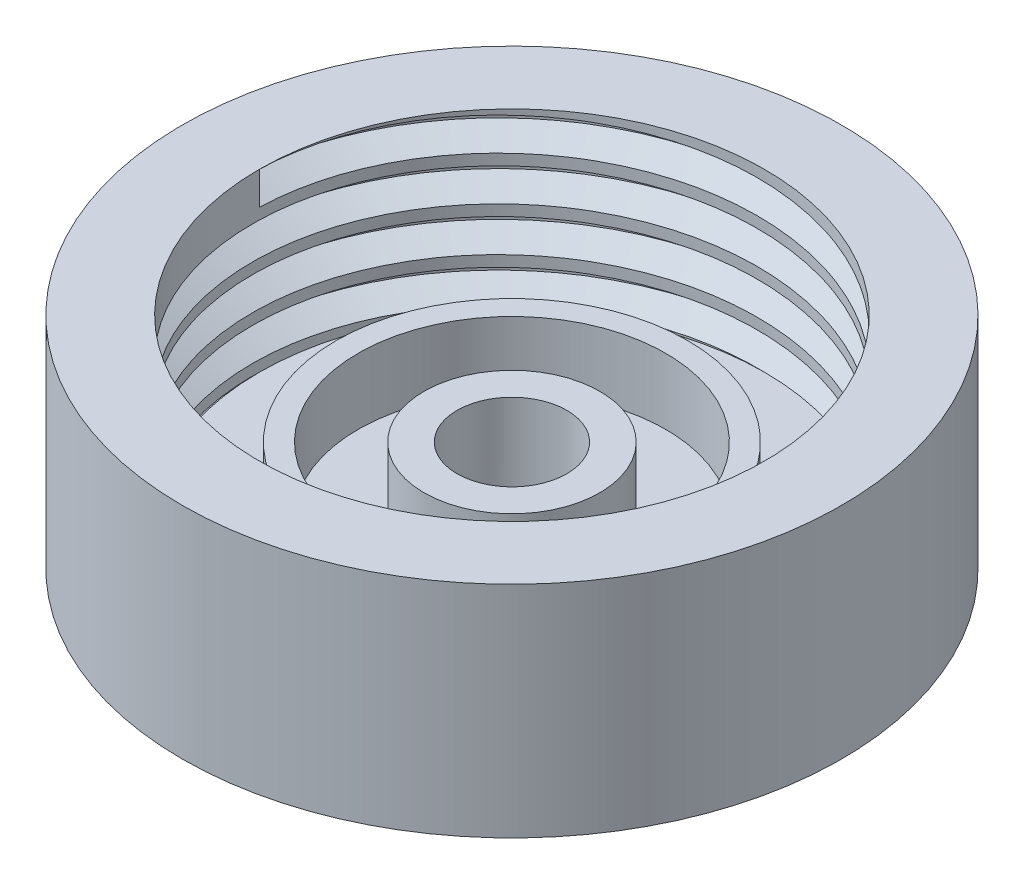
from build123d import *

# Parameters (mm, degrees)
SKETCH1_R           = 15
BOSS_EXTRUDE1_DEPTH = 2
SKETCH2_R           = 15
SKETCH2_R_2         = 11.5
BOSS_EXTRUDE2_DEPTH = 8
SKETCH3_R           = 8
SKETCH3_R_2         = 7
SKETCH3_R_3         = 4
SKETCH3_R_4         = 2.5
BOSS_EXTRUDE3_DEPTH = 3
THREAD2_PITCH       = 2
CUT_EXTRUDE1_START  = -5
SKETCH10_R          = 2.5
CUT_EXTRUDE1_DEPTH  = 5
BOSS_EXTRUDE4_START = 0.5
SKETCH11_R          = 10
SKETCH11_R_2        = 2.5
BOSS_EXTRUDE4_DEPTH = 0.5


with BuildPart() as part:
    # Sketch1 → Boss-Extrude1 (new body)
    with BuildSketch(Plane(origin=(0, 0, 0), x_dir=(1, 0, 0), z_dir=(0, 1, 0))):
        with Locations(Location((0, 0, 0), (0, 0, 270))):
            Circle(SKETCH1_R)
    extrude(amount=BOSS_EXTRUDE1_DEPTH)

    # Sketch2 → Boss-Extrude2 (add)
    with BuildSketch(Plane(origin=(0, 2, 0), x_dir=(1, 0, 0), z_dir=(0, 1, 0))):
        with Locations(Location((0, 0, 0), (0, 0, 270))):
            Circle(SKETCH2_R)
        with Locations(Location((0, 0, 0), (0, 0, 270))):
            Circle(SKETCH2_R_2, mode=Mode.SUBTRACT)
    extrude(amount=BOSS_EXTRUDE2_DEPTH)

    # Sketch3 → Boss-Extrude3 (add)
    # profile 1 of 2: a face of its own
    with BuildSketch(Plane(origin=(0, 2, 0), x_dir=(1, 0, 0), z_dir=(0, 1, 0))):
        with Locations(Location((0, 0, 0), (0, 0, 270))):
            Circle(SKETCH3_R)
        with Locations(Location((0, 0, 0), (0, 0, 270))):
            Circle(SKETCH3_R_2, mode=Mode.SUBTRACT)
    # profile 2 of 2: a face of its own
    with BuildSketch(Plane(origin=(0, 2, 0), x_dir=(1, 0, 0), z_dir=(0, 1, 0))):
        with Locations(Location((0, 0, 0), (0, 0, 270))):
            Circle(SKETCH3_R_3)
        with Locations(Location((0, 0, 0), (0, 0, 270))):
            Circle(SKETCH3_R_4, mode=Mode.SUBTRACT)
    extrude(amount=BOSS_EXTRUDE3_DEPTH)

    # Thread2: the profile of Thread Profile2 profile screwed along a right-hand helix of 4 turns, 10 arcs to a turn; built about Z, then put on its axis
    thread2_z = Axis((0, 0, 0), (0, 0, 1))
    thread2_corners = [(11.4997, 0, -0.000173205), (12.58253175, 0, 0.624999997), (12.58253175, 0, 0.874999997), (11.4997, 0, 1.5001732)]
    with BuildLine(mode=Mode.PRIVATE) as thread2_profile:
        Line(thread2_corners[0], thread2_corners[1])
        Line(thread2_corners[1], thread2_corners[2])
        Line(thread2_corners[2], thread2_corners[3])
        Line(thread2_corners[3], thread2_corners[0])
    thread2_cap = Face(thread2_profile.wire())
    thread2_turn_angles = [0, 18, 36, 54, 72, 90, 108, 126, 144, 162, 180, 198, 216, 234, 252, 270, 288, 306, 324, 342, 360]
    thread2_turn_weights = [1, 0.9510565162951535, 1, 0.9510565162951535, 1, 0.9510565162951535, 1, 0.9510565162951535, 1, 0.9510565162951535, 1, 0.9510565162951535, 1, 0.9510565162951535, 1, 0.9510565162951535, 1, 0.9510565162951535, 1, 0.9510565162951535, 1]
    thread2_turn_rails = [Edge.make_bspline([Vector(p[0], p[1], 0).rotate(thread2_z, thread2_turn_angles[k]) / thread2_turn_weights[k] + Vector(0, 0, p[2] + THREAD2_PITCH * thread2_turn_angles[k] / 360) for k in range(21)], [0, 0, 0, 1, 1, 2, 2, 3, 3, 4, 4, 5, 5, 6, 6, 7, 7, 8, 8, 9, 9, 10, 10, 10], 2, thread2_turn_weights) for p in thread2_corners]
    thread2_turn_sides = [Face.make_surface_from_curves(thread2_turn_rails[p[0]], thread2_turn_rails[p[1]]) for p in [(0, 1), (1, 2), (2, 3), (3, 0)]]
    thread2 = Plane(origin=(0, 10, 0), x_dir=(-1, 0, 0), z_dir=(0, -1, 0)) * Solid(Shell([*[p.moved(Location((0, 0, THREAD2_PITCH * i))) for i in range(4) for p in thread2_turn_sides], thread2_cap, thread2_cap.rotate(thread2_z, 1440).moved(Location((0, 0, THREAD2_PITCH * 1440 / 360)))]))
    add(thread2, mode=Mode.SUBTRACT)

    # Sketch10 → Cut-Extrude1 (cut)
    with BuildSketch(Plane(origin=(0, 2, 0), x_dir=(1, 0, 0), z_dir=(0, 1, 0)).offset(CUT_EXTRUDE1_START)):
        with Locations(Location((0, 0, 0), (0, 0, 270))):
            Circle(SKETCH10_R)
    extrude(amount=CUT_EXTRUDE1_DEPTH, mode=Mode.SUBTRACT)

    # Sketch11 → Boss-Extrude4 (add)
    with BuildSketch(Plane.XZ.offset(BOSS_EXTRUDE4_START)):
        with Locations(Location((0, 0, 0), (0, 0, 270))):
            Circle(SKETCH11_R)
        with Locations(Location((0, 0, 0), (0, 0, 270))):
            Circle(SKETCH11_R_2, mode=Mode.SUBTRACT)
    extrude(amount=-BOSS_EXTRUDE4_DEPTH)


solid = part.part
